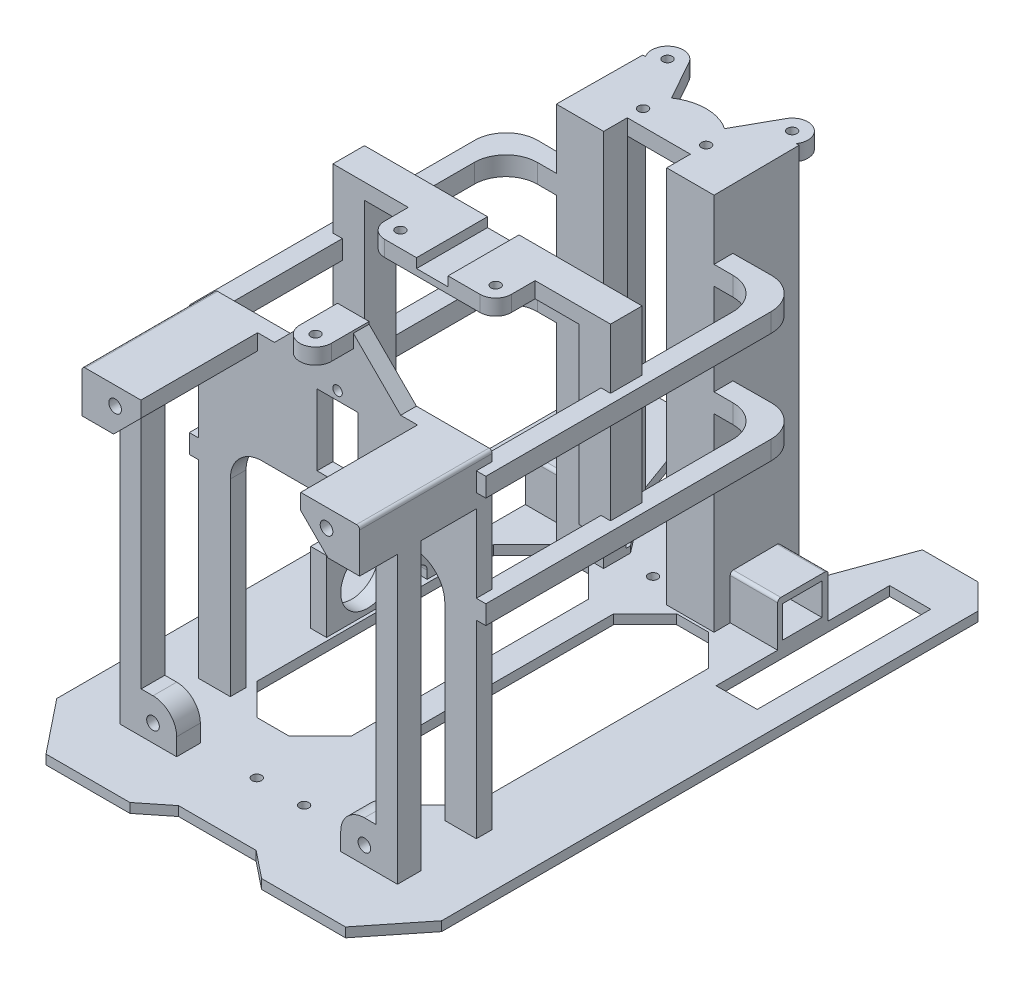
from build123d import *

# Parameters (mm, degrees)
BOSS_EXTRUDE1_DEPTH      = 40
BOSS_EXTRUDE1_DEPTH_BACK = 40
SKETCH1_W                = 12
SKETCH1_H                = 10
SKETCH2_R                = 1.5
SKETCH2_W                = 13
SKETCH2_H                = 55
BOSS_EXTRUDE2_DEPTH      = 3
SKETCH10_R               = 1.5
SKETCH10_W               = 13
SKETCH10_H               = 22.5
BOSS_EXTRUDE3_DEPTH      = 5
SKETCH11_R               = 1.5
BOSS_EXTRUDE4_DEPTH      = 5
BOSS_EXTRUDE4_2_DEPTH    = 5
BOSS_EXTRUDE4_3_DEPTH    = 5
SKETCH12_W               = 10
SKETCH12_H               = 3
CUT_EXTRUDE1_DEPTH       = 22.5
SKETCH13_W               = 10
SKETCH13_H               = 10
BOSS_EXTRUDE5_DEPTH      = 115
SKETCH15_R               = 2
BOSS_EXTRUDE6_DEPTH      = 7.5
CUT_EXTRUDE3_REACH       = 205.381
CUT_EXTRUDE4_DEPTH       = 213.327635102
CUT_EXTRUDE4_DEPTH_BACK  = 213.327635102
SKETCH18_W               = 12.000416082
SKETCH18_H               = 10
BOSS_EXTRUDE7_DEPTH      = 6
CUT_EXTRUDE5_DEPTH       = 204.381225414
CUT_EXTRUDE5_DEPTH_BACK  = 204.381225414
SKETCH20_W               = 39.567559193
SKETCH20_H               = 60
BOSS_EXTRUDE8_START      = -25
SKETCH21_R               = 2
BOSS_EXTRUDE8_DEPTH      = 37
SKETCH23_W               = 10
SKETCH23_H               = 5
BOSS_EXTRUDE9_DEPTH      = 10.75
CHAMFER1_SIZE            = 15
LPATTERN2_COUNT          = 2
LPATTERN2_PITCH          = 35
SKETCH24_R               = 8.5
BOSS_EXTRUDE10_DEPTH     = 5
CHAMFER2_SIZE            = 3


with BuildPart() as part:
    # Sketch1 → Boss-Extrude1 (new, two sides: drawn at the far end of the back side and taken through both)
    with BuildSketch(Plane(origin=(0, 0, 0), x_dir=(0, 0, -1), z_dir=(1, 0, 0)).offset(-BOSS_EXTRUDE1_DEPTH_BACK)):
        with BuildLine():
            Line((8, 0), (8, 13))
            ThreePointArc((8, 13), (7.707106781, 13.707106781), (7, 14))
            Line((7, 14), (-7, 14))
            ThreePointArc((-7, 14), (-7.707106781, 13.707106781), (-8, 13))
            Line((-8, 13), (-8, 0))
            Line((-8, 0), (8, 0))
        make_face()
        with Locations((0, 7)):
            Rectangle(SKETCH1_W, SKETCH1_H, mode=Mode.SUBTRACT)
    extrude(amount=BOSS_EXTRUDE1_DEPTH + BOSS_EXTRUDE1_DEPTH_BACK)

    # Sketch2 → Boss-Extrude2 (add)
    with BuildSketch(Plane(origin=(0, 0, 0), x_dir=(1, 0, 0), z_dir=(0, 1, 0))):
        Polygon((-61, -135.5), (-61, 34.5), (-53, 42.5), (-35.373151677, 42.5), (-25, 14), (25, 14), (35.373151677, 42.5), (53, 42.5), (61, 34.5), (61, -135.5), (47.460305788, -152.456298168), (20.880144596, -152.456298168), (12.298787506, -145.604038921), (-12.298787506, -145.604038921), (-20.880144596, -152.456298168), (-47.460305788, -152.456298168), align=None)
        with Locations(Location((-7.5, -125.604038921, 0), (0, 0, 270))):
            Circle(SKETCH2_R, mode=Mode.SUBTRACT)
        with Locations(Location((7.5, -125.604038921, 0), (0, 0, 90))):
            Circle(SKETCH2_R, mode=Mode.SUBTRACT)
        with Locations(Location((0, -7.5, 0), (0, 0, 270))):
            Circle(SKETCH2_R, mode=Mode.SUBTRACT)
        with Locations(Location((0, 7.5, 0), (0, 0, 19.471220634))):
            Circle(SKETCH2_R, mode=Mode.SUBTRACT)
        with Locations((-46.5, 0)):
            Rectangle(SKETCH2_W, SKETCH2_H, mode=Mode.SUBTRACT)
        Polygon((-4, -99), (-4, -24), (-14, -14), (-24, -14), (-34, -24), (-34, -99), (-24, -109), (-14, -109), align=None, mode=Mode.SUBTRACT)
        Polygon((14, -109), (4, -99), (4, -24), (14, -14), (24, -14), (34, -24), (34, -99), (24, -109), align=None, mode=Mode.SUBTRACT)
        with Locations((46.5, 0)):
            Rectangle(SKETCH2_W, SKETCH2_H, mode=Mode.SUBTRACT)
    extrude(amount=-BOSS_EXTRUDE2_DEPTH)

    # Sketch10 → Boss-Extrude3 (add)
    with BuildSketch(Plane(origin=(0, 0, 102.5), x_dir=(-1, 0, 0), z_dir=(0, 0, -1))):
        with BuildLine():
            Line((34, 0), (34, 59.75))
            ThreePointArc((34, 59.75), (31.071067812, 66.821067812), (24, 69.75))
            Line((24, 69.75), (-24, 69.75))
            ThreePointArc((-24, 69.75), (-31.071067812, 66.821067812), (-34, 59.75))
            Line((-34, 59.75), (-34, 0))
            Line((-34, 0), (-44, 0))
            Line((-44, 0), (-44, 103.25))
            ThreePointArc((-44, 103.25), (-43.707106781, 103.957106781), (-43, 104.25))
            Line((-43, 104.25), (43, 104.25))
            ThreePointArc((43, 104.25), (43.707106781, 103.957106781), (44, 103.25))
            Line((44, 103.25), (44, 0))
            Line((44, 0), (34, 0))
        make_face()
        with Locations((0, 73)):
            Circle(SKETCH10_R, mode=Mode.SUBTRACT)
        with Locations((0, 101)):
            Circle(SKETCH10_R, mode=Mode.SUBTRACT)
        with Locations((0, 87)):
            Rectangle(SKETCH10_W, SKETCH10_H, mode=Mode.SUBTRACT)
    extrude(amount=-BOSS_EXTRUDE3_DEPTH)



with BuildPart() as body_2:
    # Sketch11 → Boss-Extrude4 (new body)
    with BuildSketch(Plane(origin=(0, 120, 0), x_dir=(1, 0, 0), z_dir=(0, 1, 0))):
        with BuildLine():
            Line((-10, -5.662666213), (10, -5.662666213))
            Line((10, -5.662666213), (10, -13.162666213))
            Line((10, -13.162666213), (25, -13.162666213))
            Line((25, -13.162666213), (24.773801419, 14))
            Line((24.773801419, 14), (23.892852784, 14))
            Line((23.892852784, 14), (24.117839881, 14.403822996))
            ThreePointArc((24.117839881, 14.403822996), (22.183510791, 21.205173668), (15.382160119, 19.270844578))
            Line((15.382160119, 19.270844578), (8.410504342, 6.75761626))
            ThreePointArc((8.410504342, 6.75761626), (0, 9.337333787), (-8.410504342, 6.75761626))
            Line((-8.410504342, 6.75761626), (-15.382160119, 19.270844578))
            ThreePointArc((-15.382160119, 19.270844578), (-22.183510791, 21.205173668), (-24.117839881, 14.403822996))
            Line((-24.117839881, 14.403822996), (-23.892852784, 14))
            Line((-23.892852784, 14), (-24.773801419, 14))
            Line((-24.773801419, 14), (-25, -13.162666213))
            Line((-25, -13.162666213), (-10, -13.162666213))
            Line((-10, -13.162666213), (-10, -5.662666213))
        make_face()
        with Locations(Location((10, -0.662666213, 0), (0, 0, 270))):
            Circle(SKETCH11_R, mode=Mode.SUBTRACT)
        with Locations(Location((19.75, 16.837333787, 0), (0, 0, 270))):
            Circle(SKETCH11_R, mode=Mode.SUBTRACT)
        with Locations(Location((-19.75, 16.837333787, 0), (0, 0, 270))):
            Circle(SKETCH11_R, mode=Mode.SUBTRACT)
        with Locations(Location((-10, -0.662666213, 0), (0, 0, 270))):
            Circle(SKETCH11_R, mode=Mode.SUBTRACT)
    extrude(amount=-BOSS_EXTRUDE4_DEPTH)


with BuildPart() as body_3:
    # Sketch11 → Boss-Extrude4 2 (new body)
    with BuildSketch(Plane(origin=(0, 120, 0), x_dir=(1, 0, 0), z_dir=(0, 1, 0))):
        with BuildLine():
            Line((-15.1, -77.476020518), (15.1, -77.476020518))
            ThreePointArc((15.1, -77.476020518), (18.635533906, -76.011554424), (20.1, -72.476020518))
            Line((20.1, -72.476020518), (20.1, -64.976020518))
            Line((20.1, -64.976020518), (44, -64.976020518))
            Line((44, -64.976020518), (44, -54.976020518))
            Line((44, -54.976020518), (-44, -54.976020518))
            Line((-44, -54.976020518), (-44, -64.976020518))
            Line((-44, -64.976020518), (-20.1, -64.976020518))
            Line((-20.1, -64.976020518), (-20.1, -72.476020518))
            ThreePointArc((-20.1, -72.476020518), (-18.635533906, -76.011554424), (-15.1, -77.476020518))
        make_face()
        with Locations(Location((-15.1, -72.476020518, 0), (0, 0, 270))):
            Circle(SKETCH11_R, mode=Mode.SUBTRACT)
        with Locations(Location((15.1, -72.476020518, 0), (0, 0, 270))):
            Circle(SKETCH11_R, mode=Mode.SUBTRACT)
    extrude(amount=-BOSS_EXTRUDE4_2_DEPTH)

    # Sketch12 → Cut-Extrude1 (cut)
    with BuildSketch(Plane(origin=(0, 0, 54.976020518), x_dir=(-1, 0, 0), z_dir=(0, 0, -1))):
        with Locations((0, 118.5)):
            Rectangle(SKETCH12_W, SKETCH12_H)
    extrude(amount=-CUT_EXTRUDE1_DEPTH, mode=Mode.SUBTRACT)


with BuildPart() as body_4:
    # Sketch11 → Boss-Extrude4 3 (new body)
    with BuildSketch(Plane(origin=(0, 120, 0), x_dir=(1, 0, 0), z_dir=(0, 1, 0))):
        with BuildLine():
            Line((-5, -102.5), (-5, -114.476020518))
            ThreePointArc((-5, -114.476020518), (0, -119.476020518), (5, -114.476020518))
            Line((5, -114.476020518), (5, -102.5))
            Line((5, -102.5), (-5, -102.5))
        make_face()
        with Locations(Location((0, -114.476020518, 0), (0, 0, 270))):
            Circle(SKETCH11_R, mode=Mode.SUBTRACT)
    extrude(amount=-BOSS_EXTRUDE4_3_DEPTH)


with BuildPart() as part_1:
    add(part.part)

    add(body_2.part)  # Boss-Extrude5 merges body 2

    add(body_3.part)  # Boss-Extrude5 merges body 3
    # Sketch13 → Boss-Extrude5 (add)
    with BuildSketch(Plane.XZ.offset(-115)):
        with Locations((39, 59.976020518)):
            Rectangle(SKETCH13_W, SKETCH13_H)
        with Locations((-39, 59.976020518)):
            Rectangle(SKETCH13_W, SKETCH13_H)
        Polygon((-10, 5.662666213), (-23.892852784, -14), (-24.773801419, -14), (-25, 13.162666213), (-10, 13.162666213), align=None)
        Polygon((24.773801419, -14), (23.892852784, -14), (10, 5.662666213), (10, 13.162666213), (25, 13.162666213), align=None)
    extrude(amount=BOSS_EXTRUDE5_DEPTH)

    # Sketch15 → Boss-Extrude6 (add)
    # profile 1 of 2: a face of its own
    with BuildSketch(Plane.XY.offset(132.5)):
        with BuildLine():
            Line((-26, 5.5), (-26, 0))
            Line((-26, 0), (-41, 0))
            Line((-41, 0), (-44, 0))
            Line((-44, 0), (-44, 100))
            Line((-44, 100), (-37.25, 100))
            Line((-37.25, 100), (-37.25, 13))
            Line((-37.25, 13), (-33.5, 13))
            ThreePointArc((-33.5, 13), (-28.196699141, 10.803300859), (-26, 5.5))
        make_face()
        with Locations((-33.5, 5.5)):
            Circle(SKETCH15_R, mode=Mode.SUBTRACT)
    # profile 2 of 2: a face of its own
    with BuildSketch(Plane.XY.offset(132.5)):
        with BuildLine():
            Line((44, 0), (44, 100))
            Line((44, 100), (37.25, 100))
            Line((37.25, 100), (37.25, 13))
            Line((37.25, 13), (33.5, 13))
            ThreePointArc((33.5, 13), (28.196699141, 10.803300859), (26, 5.5))
            Line((26, 5.5), (26, 0))
            Line((26, 0), (41, 0))
            Line((41, 0), (44, 0))
        make_face()
        with Locations((33.5, 5.5)):
            Circle(SKETCH15_R, mode=Mode.SUBTRACT)
    extrude(amount=-BOSS_EXTRUDE6_DEPTH)

    # Cut-Extrude3: up to this face of the body (flat: up to its plane)
    cut_extrude3_end = Plane(part_1.part.faces().sort_by_distance((0, 14, -0.800553089))[0])
    # Sketch17 → Cut-Extrude3 (cut, up to the picked face)
    with BuildSketch(Plane(origin=(0, 0, 0), x_dir=(1, 0, 0), z_dir=(0, 1, 0)), mode=Mode.PRIVATE) as cut_extrude3_sk1:
        Polygon((-19.653492984, 8), (19.653492984, 8), (10, -5.662666213), (10, -8), (-10, -8), (-10, -4.662666213), align=None)
    cut_extrude3_tool1 = split(extrude(cut_extrude3_sk1.sketch, amount=CUT_EXTRUDE3_REACH, mode=Mode.PRIVATE), bisect_by=cut_extrude3_end, keep=Keep.BOTH, mode=Mode.PRIVATE)
    add(cut_extrude3_tool1.solids().sort_by(Axis((0.142706, 0, -1.024935), (0, 1, 0)))[0], mode=Mode.SUBTRACT)

    # Sketch18 → Cut-Extrude4 (cut, two sides: drawn at the far end of the back side and taken through both)
    with BuildSketch(Plane(origin=(-24.888661198, 0, -0.207261681), x_dir=(-0.008327265684680321, 0, 0.999965327722025), z_dir=(-0.999965327722025, 0, -0.008327265684680321)).offset(-CUT_EXTRUDE4_DEPTH_BACK)):
        with Locations((0.207268867, 7)):
            Rectangle(SKETCH18_W, SKETCH18_H)
    extrude(amount=CUT_EXTRUDE4_DEPTH + CUT_EXTRUDE4_DEPTH_BACK, mode=Mode.SUBTRACT)

    # Sketch19 → Boss-Extrude7 (add)
    with BuildSketch(Plane(origin=(0, 60, 0), x_dir=(1, 0, 0), z_dir=(0, 1, 0))):
        with BuildLine():
            Line((41, -107.5), (47, -107.5))
            Line((47, -107.5), (47, -17.062666206))
            ThreePointArc((47, -17.062666206), (44.041564934, -9.962218102), (36.916727343, -7.063012929))
            Line((36.916727343, -7.063012929), (24.950034673, -7.162666213))
            Line((24.950034673, -7.162666213), (25, -13.162666213))
            Line((25, -13.162666213), (31, -13.162666213))
            ThreePointArc((31, -13.162666213), (38.071067812, -16.091598402), (41, -23.162666213))
            Line((41, -23.162666213), (41, -107.5))
        make_face()
        with BuildLine():
            Line((-41, -23.162666213), (-41, -107.5))
            Line((-41, -107.5), (-47, -107.5))
            Line((-47, -107.5), (-47, -17.062666206))
            ThreePointArc((-47, -17.062666206), (-44.041564934, -9.962218102), (-36.916727343, -7.063012929))
            Line((-36.916727343, -7.063012929), (-24.950034673, -7.162666213))
            Line((-24.950034673, -7.162666213), (-25, -13.162666213))
            Line((-25, -13.162666213), (-31, -13.162666213))
            ThreePointArc((-31, -13.162666213), (-38.071067812, -16.091598402), (-41, -23.162666213))
        make_face()
    boss_extrude7 = extrude(amount=BOSS_EXTRUDE7_DEPTH)

    # Sketch20 → Cut-Extrude5 (cut, two sides: drawn at the far end of the back side and taken through both)
    with BuildSketch(Plane(origin=(0, 0, 0), x_dir=(0, 0, -1), z_dir=(1, 0, 0)).offset(-CUT_EXTRUDE5_DEPTH_BACK)):
        with Locations((-61.133102737, 30)):
            Rectangle(SKETCH20_W, SKETCH20_H)
    extrude(amount=CUT_EXTRUDE5_DEPTH + CUT_EXTRUDE5_DEPTH_BACK, mode=Mode.SUBTRACT)

    # Sketch21 → Boss-Extrude8 (add)
    # profile 1 of 2: a face of its own
    with BuildSketch(Plane.XY.offset(132.5).offset(BOSS_EXTRUDE8_START)):
        with BuildLine():
            Line((43, 104.25), (25.33032212, 104.25))
            Line((25.33032212, 104.25), (25.33032212, 99.25))
            Line((25.33032212, 99.25), (34, 90.58032212))
            Line((34, 90.58032212), (44, 90.58032212))
            Line((44, 90.58032212), (44, 103.25))
            ThreePointArc((44, 103.25), (43.707106781, 103.957106781), (43, 104.25))
        make_face()
        with Locations(Location((33.5, 98.5, 0), (0, 0, 180))):
            Circle(SKETCH21_R, mode=Mode.SUBTRACT)
    # profile 2 of 2: a face of its own
    with BuildSketch(Plane.XY.offset(132.5).offset(BOSS_EXTRUDE8_START)):
        with BuildLine():
            Line((-34, 90.58032212), (-44, 90.58032212))
            Line((-44, 90.58032212), (-44, 103.25))
            ThreePointArc((-44, 103.25), (-43.707106781, 103.957106781), (-43, 104.25))
            Line((-43, 104.25), (-25.33032212, 104.25))
            Line((-25.33032212, 104.25), (-25.33032212, 99.25))
            Line((-25.33032212, 99.25), (-34, 90.58032212))
        make_face()
        with Locations(Location((-33.5, 98.5, 0), (0, 0, 180))):
            Circle(SKETCH21_R, mode=Mode.SUBTRACT)
    extrude(amount=BOSS_EXTRUDE8_DEPTH)


    add(body_4.part)  # Boss-Extrude9 merges body 4
    # Sketch23 → Boss-Extrude9 (add)
    with BuildSketch(Plane(origin=(0, 104.25, 0), x_dir=(1, 0, 0), z_dir=(0, 1, 0))):
        with Locations((0, -105)):
            Rectangle(SKETCH23_W, SKETCH23_H)
    extrude(amount=BOSS_EXTRUDE9_DEPTH)

    # Chamfer1
    # the kernel refuses this chamfer: 15 mm, written as the material it adds along each edge
    with BuildSketch(Plane(origin=(-5, 104.25, 107.5), x_dir=(-0.9996219169112968, -0.027495876610586785, 0), z_dir=(0, 0, -1))) as chamfer1_piece_1:
        Polygon((CHAMFER1_SIZE * 0.999621916911, CHAMFER1_SIZE * 0.0274958766106), (-CHAMFER1_SIZE * 0.0274958766106, CHAMFER1_SIZE * 0.999621916911), (0, 0), align=None)
    extrude(amount=5)
    with BuildSketch(Plane(origin=(5, 104.25, 102.5), x_dir=(-0.027495876610586188, 0.9996219169112966, 0), z_dir=(0, 0, 1))) as chamfer1_piece_2:
        Polygon((CHAMFER1_SIZE * 0.999621916911, -CHAMFER1_SIZE * 0.0274958766106), (-CHAMFER1_SIZE * 0.0274958766106, -CHAMFER1_SIZE * 0.999621916911), (0, 0), align=None)
    extrude(amount=5)

    # LPattern2: Boss-Extrude7 ×2
    with Locations(*[(0, i * LPATTERN2_PITCH, 0) for i in range(1, LPATTERN2_COUNT)]):
        add(boss_extrude7)

    # Sketch24 → Boss-Extrude10 (add)
    with BuildSketch(Plane(origin=(-35, 0, 0), x_dir=(0, 0, -1), z_dir=(1, 0, 0))):
        with BuildLine():
            Line((-44.1, 2.5), (-44.1, 0))
            Line((-44.1, 0), (-24, 0))
            Line((-24, 0), (-24, 22.5))
            Line((-24, 22.5), (-76, 22.5))
            Line((-76, 22.5), (-76, 0))
            Line((-76, 0), (-55.9, 0))
            Line((-55.9, 0), (-55.9, 2.5))
            ThreePointArc((-55.9, 2.5), (-55.197056275, 4.197056275), (-53.5, 4.9))
            Line((-53.5, 4.9), (-46.5, 4.9))
            ThreePointArc((-46.5, 4.9), (-44.802943725, 4.197056275), (-44.1, 2.5))
        make_face()
        with Locations((-37, 10)):
            Circle(SKETCH24_R, mode=Mode.SUBTRACT)
        with Locations((-63, 10)):
            Circle(SKETCH24_R, mode=Mode.SUBTRACT)
    extrude(amount=-BOSS_EXTRUDE10_DEPTH)

    # Chamfer2
    chamfer2_edges = [part_1.edges().sort_by_distance(p)[0] for p in [
        (-41, 60, 83.738010259),
        (41, 60, 83.738010259),
    ]]
    chamfer(chamfer2_edges, length=CHAMFER2_SIZE)


solid = part_1.part
